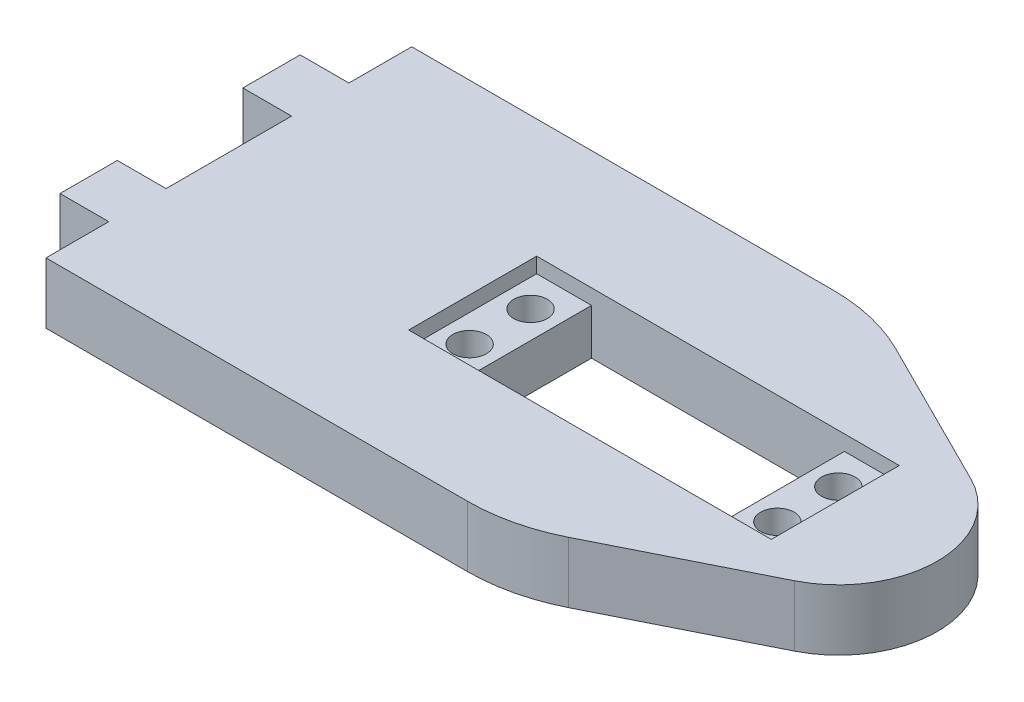
from build123d import *

# Parameters (mm, degrees)
BOSS_EXTRUDE2_DEPTH     = 10
CUT_EXTRUDE2_DEPTH      = 10
FILLET3_R               = 16
SKETCH8_W               = 8
SKETCH8_H               = 0.3
CUT_EXTRUDE5_DEPTH      = 10
BOSS_EXTRUDE3_DEPTH     = 10
SKETCH9_W               = 59.5
SKETCH9_H               = 21
CUT_EXTRUDE7_DEPTH      = 2.5
CUT_EXTRUDE9_DEPTH      = 132.011508492
CUT_EXTRUDE9_DEPTH_BACK = 132.011508492
SKETCH12_W              = 41.5
SKETCH12_H              = 21
SKETCH12_R              = 2.75
FILLET4_R               = 30


with BuildPart() as part:
    # Sketch1 → Boss-Extrude2 (new body)
    with BuildSketch(Plane(origin=(0, 0, 0), x_dir=(1, 0, 0), z_dir=(0, 1, 0))):
        Polygon((0, 0), (0, 10), (-8, 10), (-8, 20), (0, 20), (0, 40), (-8, 40), (-8, 50), (0, 50), (0, 60), (50, 60), (90, 40), (90, 20), (50, 0), align=None)
    extrude(amount=BOSS_EXTRUDE2_DEPTH)

    # Sketch5 → Cut-Extrude2 (cut)
    with BuildSketch(Plane(origin=(0, 10, 0), x_dir=(1, 0, 0), z_dir=(0, 1, 0))):
        with BuildLine():
            Line((90, 20), (90, 30))
            ThreePointArc((90, 30), (87.583479317, 21.493491916), (81.05572809, 15.527864045))
            Line((81.05572809, 15.527864045), (90, 20))
        make_face()
        with BuildLine():
            Line((90, 40), (81.05572809, 44.472135955))
            ThreePointArc((81.05572809, 44.472135955), (87.583479317, 38.506508084), (90, 30))
            Line((90, 30), (90, 40))
        make_face()
    extrude(amount=-CUT_EXTRUDE2_DEPTH, mode=Mode.SUBTRACT)

    # Fillet3
    fillet3_edges = [part.edges().sort_by_distance(p)[0] for p in [
        (50, 5, -60),
        (50, 5, 0),
    ]]
    fillet(fillet3_edges, radius=FILLET3_R)

    # Sketch8 → Cut-Extrude5 (cut)
    with BuildSketch(Plane(origin=(0, 10, 0), x_dir=(1, 0, 0), z_dir=(0, 1, 0))):
        with Locations((-4, 49.85)):
            Rectangle(SKETCH8_W, SKETCH8_H)
        with Locations((-4, 40.15)):
            Rectangle(SKETCH8_W, SKETCH8_H)
        with Locations((-4, 19.85)):
            Rectangle(SKETCH8_W, SKETCH8_H)
        with Locations((-4, 10.15)):
            Rectangle(SKETCH8_W, SKETCH8_H)
    extrude(amount=-CUT_EXTRUDE5_DEPTH, mode=Mode.SUBTRACT)

    # Sketch11 → Boss-Extrude3 (add)
    with BuildSketch(Plane.XZ):
        with BuildLine():
            Line((46.22291236, 0), (76.22291236, 0))
            Line((76.22291236, 0), (107.27864045, -15.527864045))
            ThreePointArc((107.27864045, -15.527864045), (116.22291236, -30), (107.27864045, -44.472135955))
            Line((107.27864045, -44.472135955), (76.22291236, -60))
            Line((76.22291236, -60), (46.22291236, -60))
            Line((46.22291236, -60), (46.22291236, 0))
        make_face()
    extrude(amount=-BOSS_EXTRUDE3_DEPTH)

    # Sketch9 → Cut-Extrude7 (cut)
    with BuildSketch(Plane(origin=(0, 10, 0), x_dir=(1, 0, 0), z_dir=(0, 1, 0))):
        with Locations((69.75, 30)):
            Rectangle(SKETCH9_W, SKETCH9_H)
    extrude(amount=-CUT_EXTRUDE7_DEPTH, mode=Mode.SUBTRACT)

    # Sketch12 → Cut-Extrude9 (cut, two sides: drawn at the far end of the back side and taken through both)
    with BuildSketch(Plane(origin=(0, 7.5, 0), x_dir=(1, 0, 0), z_dir=(0, 1, 0)).offset(-CUT_EXTRUDE9_DEPTH_BACK)):
        with Locations((69.75, 30)):
            Rectangle(SKETCH12_W, SKETCH12_H)
        with Locations((95, 35)):
            Circle(SKETCH12_R)
        with Locations((95, 25)):
            Circle(SKETCH12_R)
        with Locations((44.5, 25)):
            Circle(SKETCH12_R)
        with Locations((44.5, 35)):
            Circle(SKETCH12_R)
    extrude(amount=CUT_EXTRUDE9_DEPTH + CUT_EXTRUDE9_DEPTH_BACK, mode=Mode.SUBTRACT)

    # Fillet4
    fillet4_edges = [part.edges().sort_by_distance(p)[0] for p in [
        (76.22291236, 5, -60),
        (76.22291236, 5, 0),
    ]]
    fillet(fillet4_edges, radius=FILLET4_R)


solid = part.part
